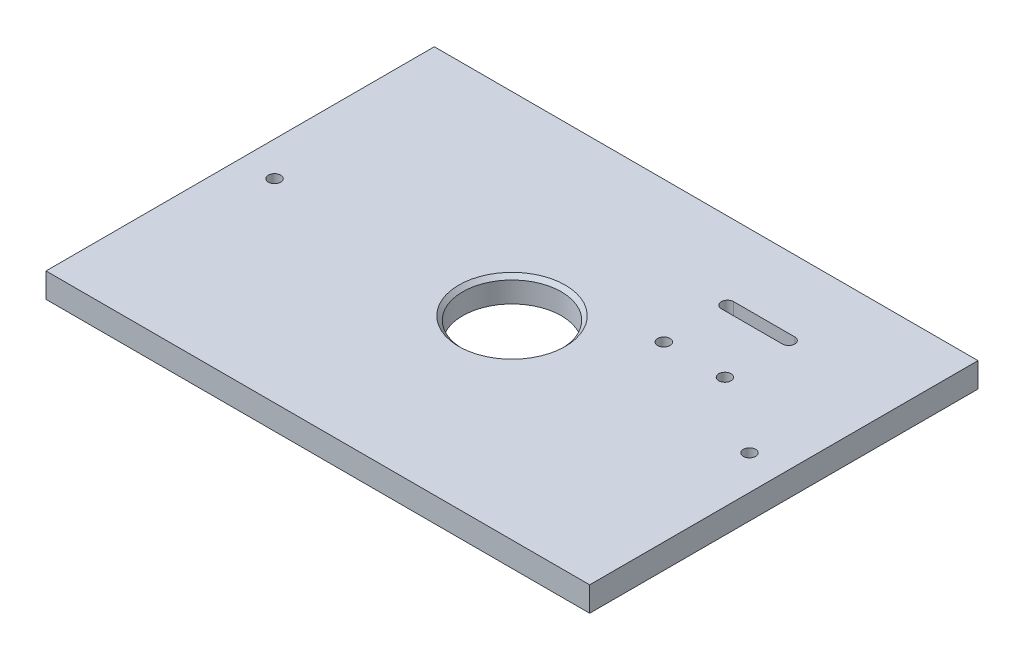
from build123d import *

# Parameters (mm, degrees)
SKETCH1_W           = 140
SKETCH1_H           = 100
BOSS_EXTRUDE1_DEPTH = 6.35
SKETCH2_R           = 12.705
CUT_EXTRUDE1_DEPTH  = 10
SKETCH3_R           = 1.5875
CUT_EXTRUDE2_DEPTH  = 10
CHAMFER1_SIZE       = 1
SKETCH4_R           = 1.5875
CUT_EXTRUDE4_DEPTH  = 10


with BuildPart() as part:
    # Sketch1 → Boss-Extrude1 (new body)
    with BuildSketch(Plane(origin=(0, 0, 0), x_dir=(1, 0, 0), z_dir=(0, 1, 0))):
        with Locations((70, 50)):
            Rectangle(SKETCH1_W, SKETCH1_H)
    extrude(amount=BOSS_EXTRUDE1_DEPTH)

    # Sketch2 → Cut-Extrude1 (cut)
    with BuildSketch(Plane(origin=(0, 6.35, 0), x_dir=(1, 0, 0), z_dir=(0, 1, 0))):
        with Locations((70, 50)):
            Circle(SKETCH2_R)
    extrude(amount=-CUT_EXTRUDE1_DEPTH, mode=Mode.SUBTRACT)

    # Sketch3 → Cut-Extrude2 (cut)
    with BuildSketch(Plane(origin=(0, 6.35, 0), x_dir=(1, 0, 0), z_dir=(0, 1, 0))):
        with Locations((8.85, 50)):
            Circle(SKETCH3_R)
        with Locations((131.15, 50)):
            Circle(SKETCH3_R)
    extrude(amount=-CUT_EXTRUDE2_DEPTH, mode=Mode.SUBTRACT)

    # Chamfer1
    chamfer1_edges = [part.edges().sort_by_distance(p)[0] for p in [
        (57.295, 6.35, -50),
    ]]
    chamfer(chamfer1_edges, length=CHAMFER1_SIZE)

    # Sketch4 → Cut-Extrude4 (cut)
    with BuildSketch(Plane(origin=(0, 6.35, 0), x_dir=(1, 0, 0), z_dir=(0, 1, 0))):
        with BuildLine():
            Line((111.13, 81.6925), (95.4, 81.6925))
            ThreePointArc((95.4, 81.6925), (93.8125, 80.105), (95.4, 78.5175))
            Line((95.4, 78.5175), (111.13, 78.5175))
            ThreePointArc((111.13, 78.5175), (112.7175, 80.105), (111.13, 81.6925))
        make_face()
        with Locations((95.4, 63.705)):
            Circle(SKETCH4_R)
        with Locations((111.13, 63.705)):
            Circle(SKETCH4_R)
    extrude(amount=-CUT_EXTRUDE4_DEPTH, mode=Mode.SUBTRACT)


solid = part.part
